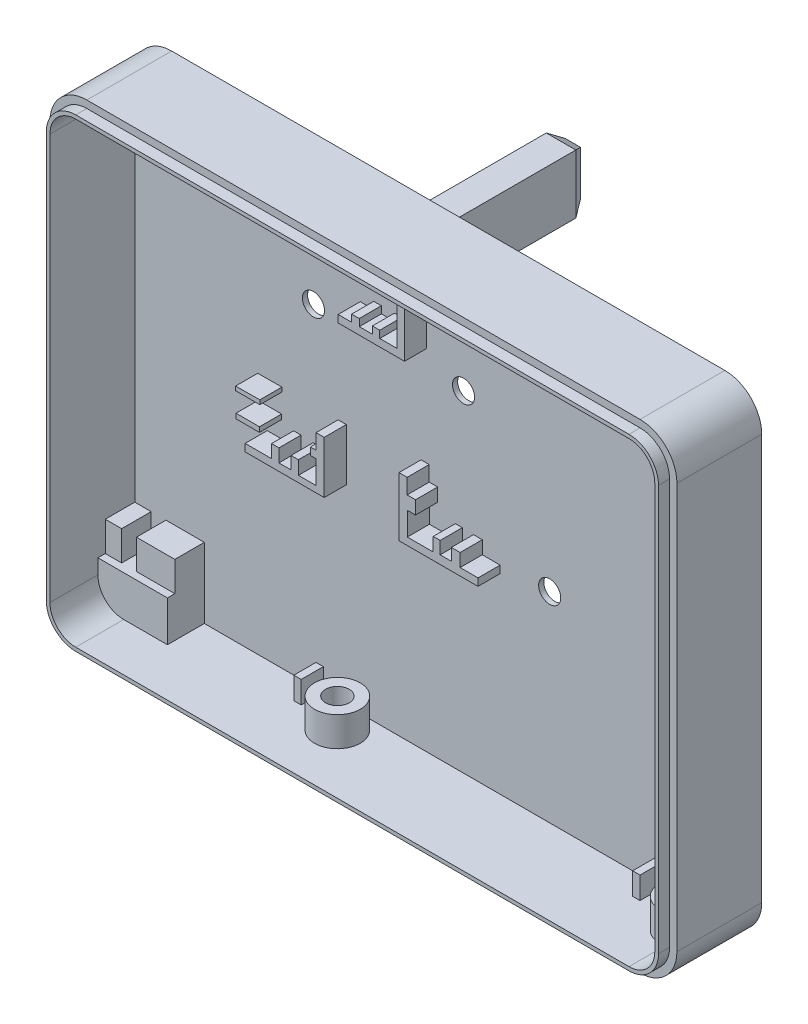
from build123d import *

# Parameters (mm, degrees)
BOSS_EXTRUDE1_DEPTH  = 13
SHELL1_T             = -1.5
SKETCH5_OUTSIDE_W    = 108.558
SKETCH5_OUTSIDE_H    = 88.558
CUT_EXTRUDE1_DEPTH   = 1.5
BOSS_EXTRUDE2_DEPTH  = 21.88
SKETCH7_3_W          = 6.48
SKETCH7_3_H          = 4
BOSS_EXTRUDE3_DEPTH  = 9.5
SKETCH7_4_W          = 6
SKETCH7_4_H          = 10
SKETCH7_4_W_2        = 4
SKETCH7_4_H_2        = 8
SKETCH7_4_W_3        = 8.48
SKETCH7_4_H_3        = 6
SKETCH7_4_W_4        = 6.48
SKETCH7_4_H_4        = 4
EXTRUDE_THIN1_DEPTH  = 0.8
SKETCH8_W            = 4
SKETCH8_H            = 8
BOSS_EXTRUDE4_DEPTH  = 1.6
BOSS_EXTRUDE4_TAPER  = 31
SKETCH11_W           = 6.48
SKETCH11_H           = 4
BOSS_EXTRUDE6_DEPTH  = 9.2
CUT_EXTRUDE3_DEPTH   = 35
SKETCH13_R           = 1.5
CUT_EXTRUDE4_DEPTH   = 1
SKETCH15_W           = 3.181637027
SKETCH15_H           = 0.661795391
BOSS_EXTRUDE7_DEPTH  = 3
SKETCH19_W           = 1
SKETCH19_H           = 3
BOSS_EXTRUDE11_DEPTH = 3
SKETCH21_R           = 3.1
SKETCH21_R_2         = 1.6
EXTRUDE_THIN2_DEPTH  = 4
BOSS_EXTRUDE12_DEPTH = 5
SKETCH23_W           = 2.221802825
SKETCH23_H           = 4.029453739
SKETCH23_W_2         = 5.206938307
BOSS_EXTRUDE13_DEPTH = 4
SKETCH25_R           = 1.5
CUT_EXTRUDE6_DEPTH   = 1.9
SKETCH27_R           = 3.5
CUT_EXTRUDE7_DEPTH   = 0.8
CHAMFER1_SIZE        = 0.4


with BuildPart() as part:
    # Sketch2 → Boss-Extrude1 (new body)
    with BuildSketch(Plane.XY):
        with BuildLine():
            Line((4.991251922, 0.007955726), (79.991251922, 0.007955726))
            ThreePointArc((79.991251922, 0.007955726), (83.526785828, -1.456510368), (84.991251922, -4.992044274))
            Line((84.991251922, -4.992044274), (84.991251922, -59.992044274))
            ThreePointArc((84.991251922, -59.992044274), (83.526785828, -63.52757818), (79.991251922, -64.992044274))
            Line((79.991251922, -64.992044274), (4.991251922, -64.992044274))
            ThreePointArc((4.991251922, -64.992044274), (1.455718016, -63.52757818), (-0.008748078, -59.992044274))
            Line((-0.008748078, -59.992044274), (-0.008748078, -4.992044274))
            ThreePointArc((-0.008748078, -4.992044274), (1.455718016, -1.456510368), (4.991251922, 0.007955726))
        make_face()
    extrude(amount=BOSS_EXTRUDE1_DEPTH)

    # Shell1
    shell1_openings = [part.faces().sort_by_distance(p)[0] for p in [
        (42.491251922, -32.492044274, 13),
    ]]
    offset(amount=SHELL1_T, openings=shell1_openings, kind=Kind.INTERSECTION)

    # Sketch5 outside → Cut-Extrude1 (cut)
    with BuildSketch(Plane.XY.offset(13)):
        with Locations((42.491, -32.492)):
            Rectangle(SKETCH5_OUTSIDE_W, SKETCH5_OUTSIDE_H)
        with BuildLine():
            Line((4.991251922, -63.992044274), (79.991251922, -63.992044274))
            ThreePointArc((79.991251922, -63.992044274), (82.819679047, -62.820471399), (83.991251922, -59.992044274))
            Line((83.991251922, -59.992044274), (83.991251922, -4.992044274))
            ThreePointArc((83.991251922, -4.992044274), (82.819679047, -2.163617149), (79.991251922, -0.992044274))
            Line((79.991251922, -0.992044274), (4.991251922, -0.992044274))
            ThreePointArc((4.991251922, -0.992044274), (2.162824797, -2.163617149), (0.991251922, -4.992044274))
            Line((0.991251922, -4.992044274), (0.991251922, -59.992044274))
            ThreePointArc((0.991251922, -59.992044274), (2.162824797, -62.820471399), (4.991251922, -63.992044274))
        make_face(mode=Mode.SUBTRACT)
    extrude(amount=-CUT_EXTRUDE1_DEPTH, mode=Mode.SUBTRACT)

    # Sketch7 → Boss-Extrude2 (add)
    with BuildSketch(Plane(origin=(0, 0, 0), x_dir=(-1, 0, 0), z_dir=(0, 0, -1))):
        Polygon((-33.903385818, -6.096643422), (-37.903385818, -6.096643422), (-37.903385818, -14.096643422), (-35.903385818, -14.096643422), (-33.903385818, -14.096643422), align=None)
    extrude(amount=BOSS_EXTRUDE2_DEPTH)

    # Sketch7<3> → Boss-Extrude3 (add)
    with BuildSketch(Plane(origin=(0, 0, 0), x_dir=(-1, 0, 0), z_dir=(0, 0, -1))):
        with Locations((-24.903385818, -32.296643422)):
            Rectangle(SKETCH7_3_W, SKETCH7_3_H)
        with Locations((-46.903385818, -32.296643422)):
            Rectangle(SKETCH7_3_W, SKETCH7_3_H)
    extrude(amount=BOSS_EXTRUDE3_DEPTH)

    # Sketch7<4> → Extrude-Thin1 (add)
    # profile 1 of 3: a face of its own
    with BuildSketch(Plane(origin=(0, 0, 0), x_dir=(-1, 0, 0), z_dir=(0, 0, -1))):
        with Locations((-35.903385818, -10.096643422)):
            Rectangle(SKETCH7_4_W, SKETCH7_4_H)
        with Locations((-35.903385818, -10.096643422)):
            Rectangle(SKETCH7_4_W_2, SKETCH7_4_H_2, mode=Mode.SUBTRACT)
    # profile 2 of 3: a face of its own
    with BuildSketch(Plane(origin=(0, 0, 0), x_dir=(-1, 0, 0), z_dir=(0, 0, -1))):
        with Locations((-24.903385818, -32.296643422)):
            Rectangle(SKETCH7_4_W_3, SKETCH7_4_H_3)
        with Locations((-24.903385818, -32.296643422)):
            Rectangle(SKETCH7_4_W_4, SKETCH7_4_H_4, mode=Mode.SUBTRACT)
    # profile 3 of 3: a face of its own
    with BuildSketch(Plane(origin=(0, 0, 0), x_dir=(-1, 0, 0), z_dir=(0, 0, -1))):
        with Locations((-46.903385818, -32.296643422)):
            Rectangle(SKETCH7_4_W_3, SKETCH7_4_H_3)
        with Locations((-46.903385818, -32.296643422)):
            Rectangle(SKETCH7_4_W_4, SKETCH7_4_H_4, mode=Mode.SUBTRACT)
    extrude(amount=EXTRUDE_THIN1_DEPTH)

    # Sketch11 → Boss-Extrude6 (add)
    with BuildSketch(Plane(origin=(0, 0, -9.5), x_dir=(-1, 0, 0), z_dir=(0, 0, -1))):
        with Locations((-46.903385818, -32.296643422)):
            Rectangle(SKETCH11_W, SKETCH11_H)
        with Locations((-24.903385818, -32.296643422)):
            Rectangle(SKETCH11_W, SKETCH11_H)
    extrude(amount=BOSS_EXTRUDE6_DEPTH)

    # Sketch12 → Cut-Extrude3 (cut)
    with BuildSketch(Plane.ZY.offset(-21.663385818)):
        Polygon((-17.1, -34.296643422), (-18.7, -33.204265899), (-18.7, -34.296643422), align=None)
        Polygon((-18.7, -30.296643422), (-18.7, -31.604265899), (-17.1, -30.296643422), align=None)
    extrude(amount=-CUT_EXTRUDE3_DEPTH, mode=Mode.SUBTRACT)

    # Sketch13 → Cut-Extrude4 (cut)
    with BuildSketch(Plane.XY):
        with Locations((35.903385818, -10.096643422)):
            Circle(SKETCH13_R)
        with Locations((46.903385818, -32.296643422)):
            Circle(SKETCH13_R)
        with Locations((24.903385818, -32.296643422)):
            Circle(SKETCH13_R)
    extrude(amount=-CUT_EXTRUDE4_DEPTH, mode=Mode.SUBTRACT)

    # Sketch15 → Boss-Extrude7 (add)
    with BuildSketch(Plane.XY.offset(1.5)):
        Polygon((41.061781048, -7.848452183), (40.061781048, -7.848452183), (40.061781048, -15.136759462), (37.701703648, -15.136759462), (37.701703648, -14.166771529), (36.696853498, -14.166771529), (36.696853498, -15.136759462), (34.928826019, -15.136759462), (34.928826019, -14.175234077), (33.881479545, -14.189828952), (33.870548817, -15.136759462), (32.061781048, -15.136759462), (32.061781048, -16.136759462), (41.061781048, -16.136759462), align=None)
        with Locations((19.803448748, -33.987494412)):
            Rectangle(SKETCH15_W, SKETCH15_H)
        Polygon((21.448047748, -31.046278038), (21.448047748, -30.466936134), (18.15361504, -30.49927289), (18.15361504, -31.046278038), align=None)
        Polygon((23.031210434, -36.582865327), (19.449923054, -36.582865327), (19.449923054, -37.582865327), (30.170378087, -37.582865327), (30.170378087, -30.510146974), (29.063738452, -30.510146974), (29.063738452, -32.57914173), (28.302201069, -32.57914173), (28.302201069, -33.57914173), (29.033825741, -33.57914173), (29.033825741, -36.72330797), (26.669707928, -36.72330797), (26.669707928, -34.892889801), (25.669707928, -34.892889801), (25.669707928, -36.582865327), (24.031210434, -36.582865327), (24.031210434, -34.815434815), (23.031210434, -34.815434815), align=None)
        Polygon((40.305296317, -37.582865327), (51.02575135, -37.582865327), (51.02575135, -36.582865327), (48.60183561, -36.582865327), (48.60183561, -34.815434815), (47.407087999, -34.815434815), (47.407087999, -36.442422685), (45.897059769, -36.442422685), (45.897059769, -34.752447159), (44.95121791, -34.752447159), (44.95121791, -36.582865327), (41.441848663, -36.582865327), (41.441848663, -33.438699088), (42.557047398, -33.438699088), (42.557047398, -31.642377687), (41.411935952, -31.651860084), (41.411935952, -29.582865327), (40.305296317, -29.582865327), align=None)
    extrude(amount=BOSS_EXTRUDE7_DEPTH)

    # Sketch19 → Boss-Extrude11 (add)
    with BuildSketch(Plane.XY.offset(1.5)):
        with Locations((72.491251922, -61.992044274)):
            Rectangle(SKETCH19_W, SKETCH19_H)
        with Locations((26.554250572, -61.992044274)):
            Rectangle(SKETCH19_W, SKETCH19_H)
    extrude(amount=BOSS_EXTRUDE11_DEPTH)

    # Sketch21 → Extrude-Thin2 (add)
    # profile 1 of 2: a face of its own
    with BuildSketch(Plane(origin=(0, -63.492044274, 0), x_dir=(1, 0, 0), z_dir=(0, 1, 0))):
        with Locations((79.364168326, -5.1)):
            Circle(SKETCH21_R)
        with Locations((79.364168326, -5.1)):
            Circle(SKETCH21_R_2, mode=Mode.SUBTRACT)
    # profile 2 of 2: a face of its own
    with BuildSketch(Plane(origin=(0, -63.492044274, 0), x_dir=(1, 0, 0), z_dir=(0, 1, 0))):
        with Locations((32.458357647, -5)):
            Circle(SKETCH21_R)
        with Locations((32.458357647, -5)):
            Circle(SKETCH21_R_2, mode=Mode.SUBTRACT)
    extrude(amount=EXTRUDE_THIN2_DEPTH)

    # Sketch22 → Boss-Extrude12 (add)
    with BuildSketch(Plane.XY.offset(1.5)):
        Polygon((5.145505563, -57.992044274), (10.919993054, -57.992044274), (10.919993054, -63.492044274), (1.419993054, -63.492044274), (1.419993054, -57.992044274), align=None)
    extrude(amount=BOSS_EXTRUDE12_DEPTH)

    # Sketch23 → Boss-Extrude13 (add)
    with BuildSketch(Plane.XY.offset(1.5)):
        with Locations((2.602153335, -55.977317404)):
            Rectangle(SKETCH23_W, SKETCH23_H)
        with Locations((8.316523901, -55.977317404)):
            Rectangle(SKETCH23_W_2, SKETCH23_H)
    extrude(amount=BOSS_EXTRUDE13_DEPTH)

    # Sketch25 → Cut-Extrude6 (cut)
    with BuildSketch(Plane(origin=(0, 0, 0), x_dir=(-1, 0, 0), z_dir=(0, 0, -1))):
        with Locations((-46.060599049, -18.614983956)):
            Circle(SKETCH25_R)
        with Locations((-25.715885128, -18.614983956)):
            Circle(SKETCH25_R)
        with Locations((-57.991319025, -7.092089492)):
            Circle(SKETCH25_R)
        with Locations((-57.740748598, -36.339660593)):
            Circle(SKETCH25_R)
    extrude(amount=-CUT_EXTRUDE6_DEPTH, mode=Mode.SUBTRACT)

    # Sketch27 → Cut-Extrude7 (cut)
    with BuildSketch(Plane(origin=(0, 0, 0), x_dir=(-1, 0, 0), z_dir=(0, 0, -1))):
        with Locations((-57.991319025, -7.092089492)):
            Circle(SKETCH27_R)
        with Locations((-46.060599049, -18.614983956)):
            Circle(SKETCH27_R)
        with Locations((-25.715885128, -18.614983956)):
            Circle(SKETCH27_R)
        with Locations((-57.740748598, -36.339660593)):
            Circle(SKETCH27_R)
    extrude(amount=-CUT_EXTRUDE7_DEPTH, mode=Mode.SUBTRACT)

    # Chamfer1
    chamfer1_edges = [part.edges().sort_by_distance(p)[0] for p in [
        (29.215885128, -18.614983956, 0),
        (61.491319025, -7.092089492, 0),
        (61.240748598, -36.339660593, 0),
        (49.560599049, -18.614983956, 0),
    ]]
    chamfer(chamfer1_edges, length=CHAMFER1_SIZE)


with BuildPart() as body_2:
    # Sketch8 → Boss-Extrude4 (new body)
    with BuildSketch(Plane(origin=(0, 0, -21.88), x_dir=(-1, 0, 0), z_dir=(0, 0, -1))):
        with Locations((-35.903385818, -10.096643422)):
            Rectangle(SKETCH8_W, SKETCH8_H)
    extrude(amount=BOSS_EXTRUDE4_DEPTH, taper=BOSS_EXTRUDE4_TAPER)


solid = Compound([part.part, body_2.part])
